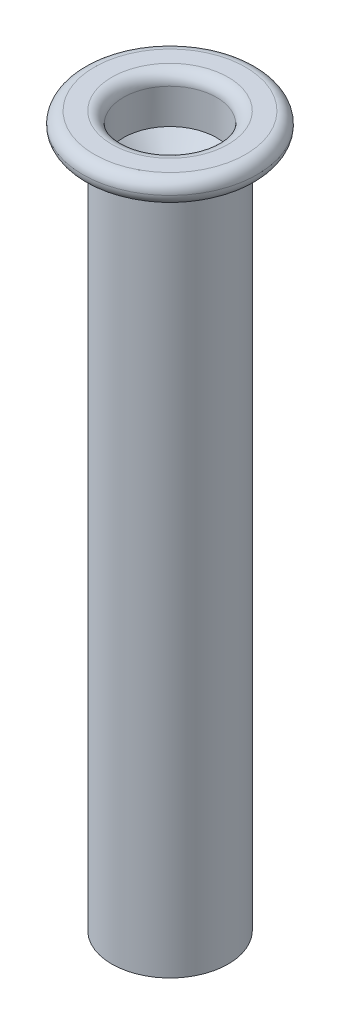
from build123d import *

# Parameters (mm, degrees)
SKETCH1_R           = 2.5
BOSS_EXTRUDE1_DEPTH = 29.5
SKETCH2_R           = 3.75
BOSS_EXTRUDE2_DEPTH = 1
SKETCH3_R           = 2
CUT_EXTRUDE2_DEPTH  = 2
FILLET1_R           = 0.5


with BuildPart() as part:
    # Sketch1 → Boss-Extrude1 (new body)
    with BuildSketch(Plane(origin=(0, 0, 0), x_dir=(1, 0, 0), z_dir=(0, 1, 0))):
        with Locations(Location((0, 0, 0), (0, 0, 270))):
            Circle(SKETCH1_R)
    extrude(amount=BOSS_EXTRUDE1_DEPTH)

    # Sketch2 → Boss-Extrude2 (add)
    with BuildSketch(Plane(origin=(0, 29.5, 0), x_dir=(1, 0, 0), z_dir=(0, 1, 0))):
        with Locations(Location((0, 0, 0), (0, 0, 270))):
            Circle(SKETCH2_R)
    extrude(amount=BOSS_EXTRUDE2_DEPTH)

    # Sketch3 → Cut-Extrude2 (cut)
    with BuildSketch(Plane(origin=(0, 30.5, 0), x_dir=(1, 0, 0), z_dir=(0, 1, 0))):
        with Locations(Location((0, 0, 0), (0, 0, 270))):
            Circle(SKETCH3_R)
    extrude(amount=-CUT_EXTRUDE2_DEPTH, mode=Mode.SUBTRACT)

    # Sketch4 → Cut-Revolve1 (revolve, cut)
    with BuildSketch(Plane.XY, mode=Mode.PRIVATE) as cut_revolve1_sk:
        Polygon((-2, 28.5), (0, 26.5), (0, 28.5), align=None)
    revolve(cut_revolve1_sk.sketch.rotate(Axis((0, 26.5, 0), (0, 1, 0)), 90), axis=Axis((0, 26.5, 0), (0, 1, 0)), mode=Mode.SUBTRACT)

    # Fillet1
    fillet1_edges = [part.edges().sort_by_distance(p)[0] for p in [
        (0, 30.5, -2),
        (0, 29.5, -3.75),
        (0, 30.5, -3.75),
    ]]
    fillet(fillet1_edges, radius=FILLET1_R - 0.0001)  # a hair under: the kernel refuses the full size


solid = part.part
